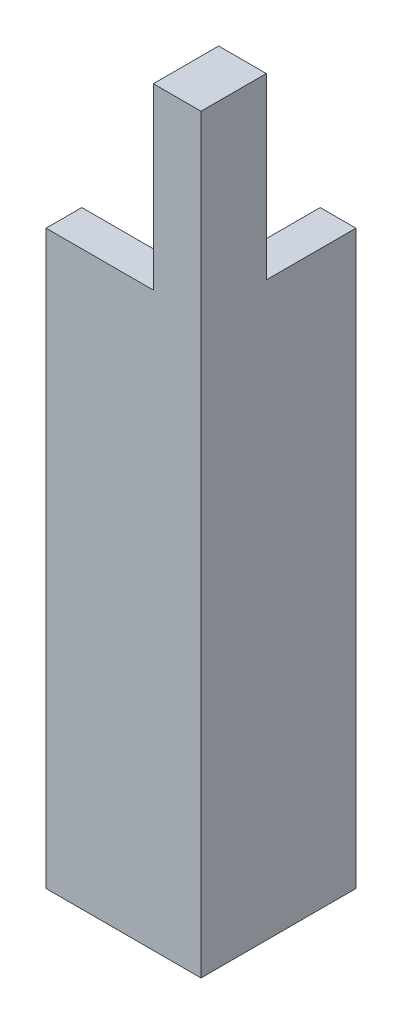
from build123d import *

# Parameters (mm, degrees)
SALIENTE_EXTRUIR1_DEPTH = 48
CROQUIS3_W              = 4
CROQUIS3_H              = 5.48
SALIENTE_EXTRUIR3_DEPTH = 15
REDONDEO1_R             = 2


with BuildPart() as part:
    # Croquis1 → Saliente-Extruir1 (new body)
    with BuildSketch(Plane(origin=(0, 0, 0), x_dir=(1, 0, 0), z_dir=(0, 1, 0))):
        Polygon((0, 0), (13, 0), (13, 13), (10, 13), (10, 3), (0, 3), align=None)
    extrude(amount=SALIENTE_EXTRUIR1_DEPTH)

    # Croquis3 → Saliente-Extruir3 (add)
    with BuildSketch(Plane(origin=(0, 48, 0), x_dir=(1, 0, 0), z_dir=(0, 1, 0))):
        with Locations((11, 2.74)):
            Rectangle(CROQUIS3_W, CROQUIS3_H)
    extrude(amount=SALIENTE_EXTRUIR3_DEPTH)

    # Redondeo1
    # the kernel refuses this fillet: 2 mm, written as the material it adds along each edge
    with BuildSketch(Plane(origin=(15, 48, -3), x_dir=(0, -1, 0), z_dir=(-1, 0, 0))) as redondeo1_piece_1_section:
        with BuildLine():
            CenterArc((REDONDEO1_R, -REDONDEO1_R), REDONDEO1_R, 90, 90)
            Line((0, -REDONDEO1_R), (0, 0))
            Line((0, 0), (REDONDEO1_R, 0))
        make_face()
    redondeo1_piece_1 = extrude(amount=6, mode=Mode.PRIVATE)
    redondeo1_piece_1 = split(redondeo1_piece_1, bisect_by=Plane(origin=(13, 47.553264122, -3.446735878), z_dir=(-1, 0, 0)), keep=Keep.TOP, mode=Mode.PRIVATE)
    add(redondeo1_piece_1)
    with BuildSketch(Plane(origin=(10, 48, -5.48), x_dir=(-1, 0, 0), z_dir=(0, 0, 1))) as redondeo1_piece_2:
        with BuildLine():
            CenterArc((2, 1.732050808), REDONDEO1_R, 180, 60)
            Line((0, 1.732050808), (0, 0))
            Line((0, 0), (1, 0))
        make_face()
    extrude(amount=2.48)


solid = part.part
